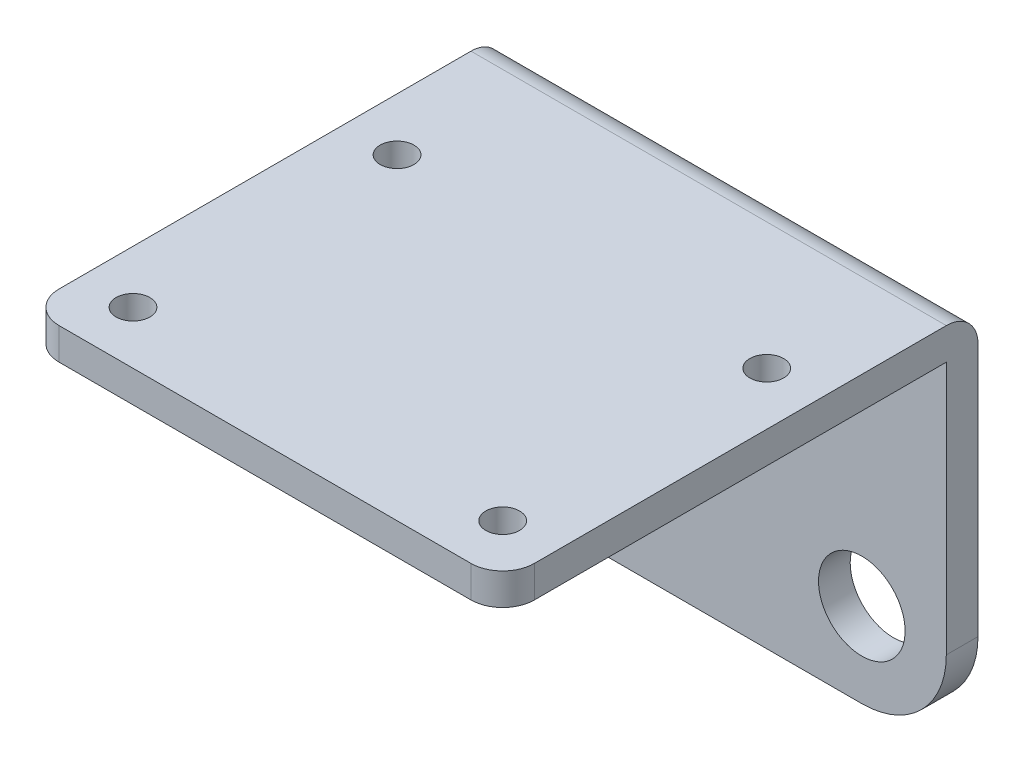
from build123d import *

# Parameters (mm, degrees)
SKETCH_1_W          = 45
SKETCH_1_H          = 45
SKETCH_1_R          = 1.6
EXTRUDE_1_DEPTH     = 3
SKETCH_2_W          = 45
SKETCH_2_H          = 3
EXTRUDE_2_DEPTH     = 32
CUT_EXTRUDE_1_REACH = 61.626
SKETCH_3_R          = 4.1
FILLET_1_R          = 3
FILLET_2_R          = 8


with BuildPart() as part:
    # 草图1 → 凸台-拉伸1 (new body)
    with BuildSketch(Plane(origin=(0, 0, 0), x_dir=(1, 0, 0), z_dir=(0, 1, 0))):
        Rectangle(SKETCH_1_W, SKETCH_1_H)
        with Locations((-17.5, -17.5)):
            Circle(SKETCH_1_R, mode=Mode.SUBTRACT)
        with Locations((17.5, -17.5)):
            Circle(SKETCH_1_R, mode=Mode.SUBTRACT)
        with Locations((17.5, 7.5)):
            Circle(SKETCH_1_R, mode=Mode.SUBTRACT)
        with Locations((-17.5, 7.5)):
            Circle(SKETCH_1_R, mode=Mode.SUBTRACT)
    extrude(amount=EXTRUDE_1_DEPTH)

    # 草图2 → 凸台-拉伸2 (add)
    with BuildSketch(Plane.XZ):
        with Locations((0, -21)):
            Rectangle(SKETCH_2_W, SKETCH_2_H)
    extrude(amount=EXTRUDE_2_DEPTH)

    # 草图3 → 切除-拉伸1 (cut, up to next)
    with BuildSketch(Plane(origin=(0, 0, -22.5), x_dir=(-1, 0, 0), z_dir=(0, 0, -1)), mode=Mode.PRIVATE) as cut_extrude_1_sk1:
        with Locations((-14.5, -24)):
            Circle(SKETCH_3_R)
    cut_extrude_1_tool1 = extrude(cut_extrude_1_sk1.sketch, amount=-CUT_EXTRUDE_1_REACH, mode=Mode.PRIVATE) & part.part
    # 草图3 → 切除-拉伸1 (cut, up to next)
    with BuildSketch(Plane(origin=(0, 0, -22.5), x_dir=(-1, 0, 0), z_dir=(0, 0, -1)), mode=Mode.PRIVATE) as cut_extrude_1_sk2:
        with Locations((14.5, -24)):
            Circle(SKETCH_3_R)
    cut_extrude_1_tool2 = extrude(cut_extrude_1_sk2.sketch, amount=-CUT_EXTRUDE_1_REACH, mode=Mode.PRIVATE) & part.part
    add(cut_extrude_1_tool1.solids().sort_by_distance((14.5, -24, -22.5))[0], mode=Mode.SUBTRACT)
    add(cut_extrude_1_tool2.solids().sort_by_distance((-14.5, -24, -22.5))[0], mode=Mode.SUBTRACT)

    # 圆角1
    fillet_1_edges = [part.edges().sort_by_distance(p)[0] for p in [
        (0, 3, -22.5),
        (22.5, 1.5, 22.5),
        (-22.5, 1.5, 22.5),
    ]]
    fillet(fillet_1_edges, radius=FILLET_1_R)

    # 圆角2
    fillet_2_edges = [part.edges().sort_by_distance(p)[0] for p in [
        (-22.5, -32, -21),
        (22.5, -32, -21),
    ]]
    fillet(fillet_2_edges, radius=FILLET_2_R)


solid = part.part
